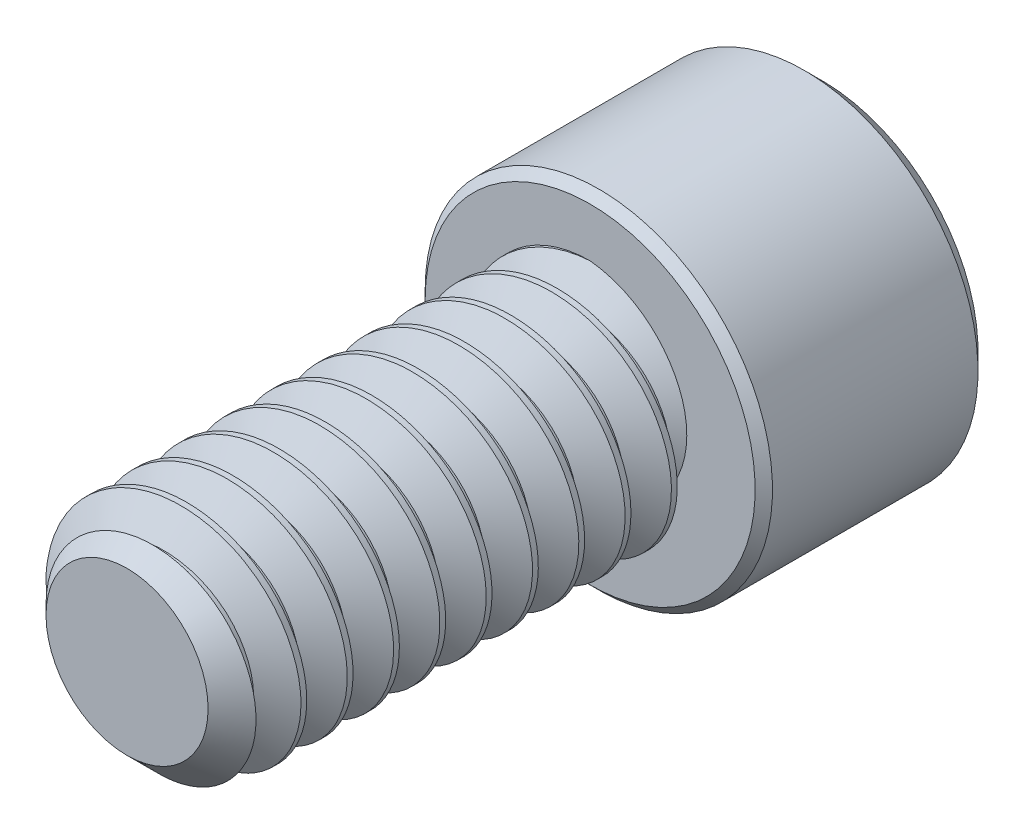
from build123d import *

# Parameters (mm, degrees)
SKETCH1_R          = 3.175
EXTRUDE1_DEPTH     = 12.7
CHAMFER3_SIZE      = 0.9525
CUT_SWEEP1_PITCH   = 1.27
SKETCH6_R          = 4.7625
EXTRUDE2_DEPTH     = 6.35
CUT_EXTRUDE1_DEPTH = 3.571875
CHAMFER1_SIZE      = 0.47625
CHAMFER2_SIZE      = 0.238125


with BuildPart() as part:
    # Sketch1 → Extrude1 (new body)
    with BuildSketch(Plane.XY):
        Circle(SKETCH1_R)
    extrude(amount=-EXTRUDE1_DEPTH)

    # Chamfer3
    chamfer3_edges = [part.edges().sort_by_distance(p)[0] for p in [
        (-3.175, 0, 0),
    ]]
    chamfer(chamfer3_edges, length=CHAMFER3_SIZE)

    # Cut-Sweep1: the profile of Sketch3 profile screwed along a right-hand helix of 11 turns, 6 arcs to a turn; built about Z, then put on its axis
    cut_sweep1_z = Axis((0, 0, 0), (0, 0, 1))
    cut_sweep1_corners = [(3.1753, 0, -1.111423205), (2.350110803, 0, -0.635), (2.350110803, 0, -0.47625), (3.1753, 0, 0.000173205)]
    with BuildLine(mode=Mode.PRIVATE) as cut_sweep1_profile:
        Line(cut_sweep1_corners[0], cut_sweep1_corners[1])
        Line(cut_sweep1_corners[1], cut_sweep1_corners[2])
        Line(cut_sweep1_corners[2], cut_sweep1_corners[3])
        Line(cut_sweep1_corners[3], cut_sweep1_corners[0])
    cut_sweep1_cap = Face(cut_sweep1_profile.wire())
    cut_sweep1_turn_angles = [0, 30, 60, 90, 120, 150, 180, 210, 240, 270, 300, 330, 360]
    cut_sweep1_turn_weights = [1, 0.8660254037844387, 1, 0.8660254037844387, 1, 0.8660254037844387, 1, 0.8660254037844387, 1, 0.8660254037844387, 1, 0.8660254037844387, 1]
    cut_sweep1_turn_rails = [Edge.make_bspline([Vector(p[0], p[1], 0).rotate(cut_sweep1_z, cut_sweep1_turn_angles[k]) / cut_sweep1_turn_weights[k] + Vector(0, 0, p[2] + CUT_SWEEP1_PITCH * cut_sweep1_turn_angles[k] / 360) for k in range(13)], [0, 0, 0, 1, 1, 2, 2, 3, 3, 4, 4, 5, 5, 6, 6, 6], 2, cut_sweep1_turn_weights) for p in cut_sweep1_corners]
    cut_sweep1_turn_sides = [Face.make_surface_from_curves(cut_sweep1_turn_rails[p[0]], cut_sweep1_turn_rails[p[1]]) for p in [(0, 1), (1, 2), (2, 3), (3, 0)]]
    cut_sweep1 = Plane(origin=(0, 0, 0), x_dir=(0, 1, 0), z_dir=(0, 0, -1)) * Solid(Shell([*[p.moved(Location((0, 0, CUT_SWEEP1_PITCH * i))) for i in range(11) for p in cut_sweep1_turn_sides], cut_sweep1_cap, cut_sweep1_cap.rotate(cut_sweep1_z, 3960).moved(Location((0, 0, CUT_SWEEP1_PITCH * 3960 / 360)))]))
    add(cut_sweep1, mode=Mode.SUBTRACT)

    # Sketch6 → Extrude2 (add)
    with BuildSketch(Plane(origin=(0, 0, -12.7), x_dir=(-1, 0, 0), z_dir=(0, 0, -1))):
        Circle(SKETCH6_R)
    extrude(amount=EXTRUDE2_DEPTH)

    # Sketch7 → Cut-Extrude1 (cut)
    with BuildSketch(Plane(origin=(0, 0, -19.05), x_dir=(-1, 0, 0), z_dir=(0, 0, -1))):
        Polygon((0, 2.749630657), (-2.38125, 1.374815329), (-2.38125, -1.374815329), (0, -2.749630657), (2.38125, -1.374815329), (2.38125, 1.374815329), align=None)
    extrude(amount=-CUT_EXTRUDE1_DEPTH, mode=Mode.SUBTRACT)

    # Cut-Extrude2 cone 1 section (through the dimple's axis) → Cut-Extrude2 (revolve, cut)
    with BuildSketch(Plane(origin=(0, 0, -19.05), x_dir=(0, 1, 0), z_dir=(1, 0, 0))):
        Polygon((0, 0), (2.749630657, 0), (0, 2.749630657), align=None)
    revolve(axis=Axis((0, 0, -19.05), (0, 0, 1)), mode=Mode.SUBTRACT)

    # Chamfer1
    chamfer1_edges = [part.edges().sort_by_distance(p)[0] for p in [
        (4.7625, 0, -19.05),
    ]]
    chamfer(chamfer1_edges, length=CHAMFER1_SIZE)

    # Chamfer2
    chamfer2_edges = [part.edges().sort_by_distance(p)[0] for p in [
        (4.7625, 0, -12.7),
    ]]
    chamfer(chamfer2_edges, length=CHAMFER2_SIZE)


solid = part.part
